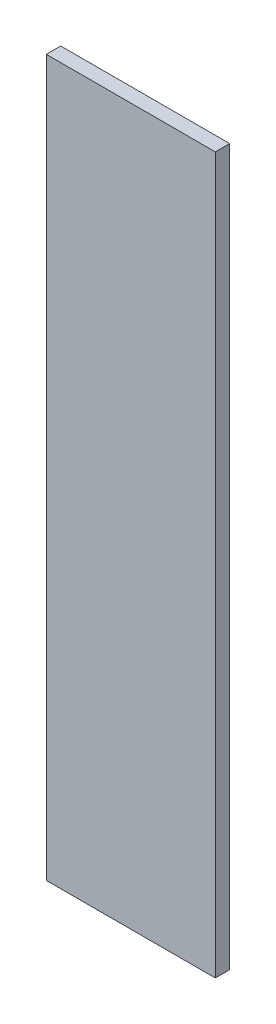
from build123d import *

# Parameters (mm, degrees)
SKETCH1_W           = 23.5
SKETCH1_H           = 99.5
BOSS_EXTRUDE1_DEPTH = 2


with BuildPart() as part:
    # Sketch1 → Boss-Extrude1 (new body)
    with BuildSketch(Plane.XY):
        with Locations((-45.25, -13.75)):
            Rectangle(SKETCH1_W, SKETCH1_H)
    extrude(amount=BOSS_EXTRUDE1_DEPTH)


solid = part.part
